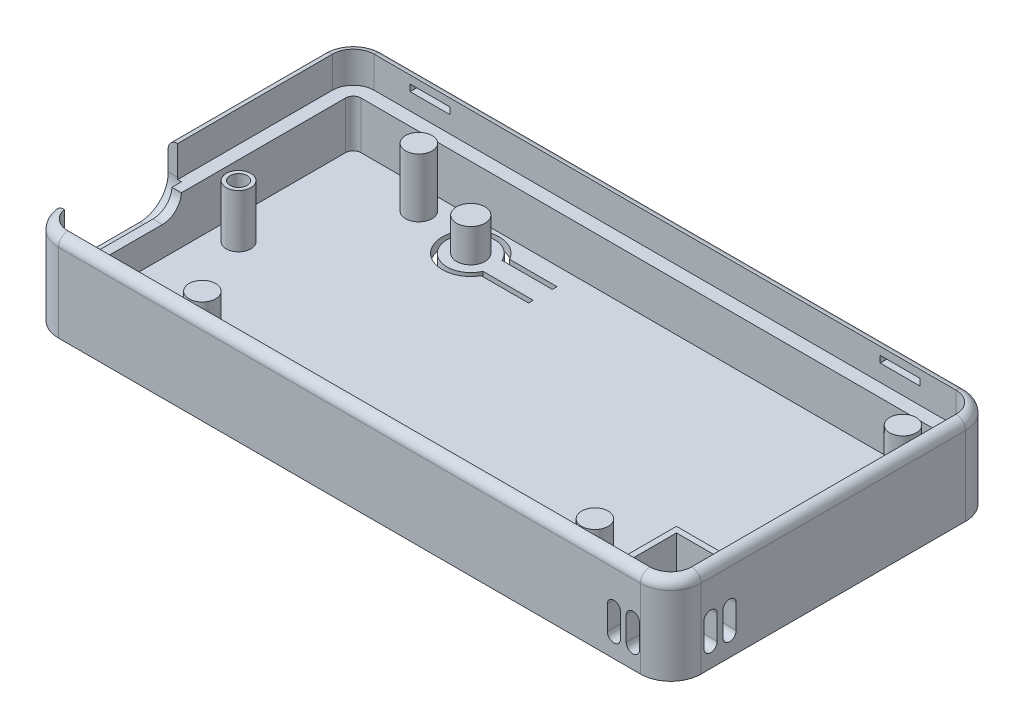
from build123d import *

# Parameters (mm, degrees)
EXTRUDE_1_DEPTH        = 9.3
CUT_EXTRUDE_1_DEPTH    = 3.3
CUT_EXTRUDE_2_DEPTH    = 5
SKETCH_5_W             = 4.2
SKETCH_5_H             = 0.7
CUT_EXTRUDE_4_DEPTH    = 0.7
FILLET_8_R             = 0.5
FILLET_8_OF_MIRROR_2_R = 0.5
FILLET_4_R             = 1
EXTRUDE_2_DEPTH        = 6.2
CUT_EXTRUDE_6_DEPTH    = 39.887305126
SKETCH_10_R            = 1.5
EXTRUDE_3_DEPTH        = 3.5
CUT_EXTRUDE_7_DEPTH    = 3
SKETCH_12_R            = 1.3
EXTRUDE_4_DEPTH        = 5.6
CUT_EXTRUDE_8_DEPTH    = 1.4
SKETCH_14_W            = 11.99666574
SKETCH_14_H            = 3.3
CUT_EXTRUDE_9_DEPTH    = 6.6
SKETCH_15_R            = 0.9
CUT_EXTRUDE_10_DEPTH   = 39.560245221
SKETCH_16_R            = 1.4
EXTRUDE_5_DEPTH        = 6.2
SKETCH_18_W            = 4.2
SKETCH_18_H            = 0.7
CUT_EXTRUDE_11_DEPTH   = 0.7
CUT_EXTRUDE_12_DEPTH   = 69.247875559
CUT_EXTRUDE_13_DEPTH   = 48.469042635
CUT_EXTRUDE_14_DEPTH   = 39.887305279


with BuildPart() as part:
    # 草图1 → 凸台-拉伸1 (new body)
    with BuildSketch(Plane(origin=(0, 0, 0), x_dir=(1, 0, 0), z_dir=(0, 1, 0))):
        with BuildLine():
            Line((-30.7, 17.15), (30.7, 17.15))
            ThreePointArc((30.7, 17.15), (32.9627417, 16.2127417), (33.9, 13.95))
            Line((33.9, 13.95), (33.9, -13.95))
            ThreePointArc((33.9, -13.95), (32.9627417, -16.2127417), (30.7, -17.15))
            Line((30.7, -17.15), (-30.7, -17.15))
            ThreePointArc((-30.7, -17.15), (-32.9627417, -16.2127417), (-33.9, -13.95))
            Line((-33.9, -13.95), (-33.9, 13.95))
            ThreePointArc((-33.9, 13.95), (-32.9627417, 16.2127417), (-30.7, 17.15))
        make_face()
    extrude(amount=EXTRUDE_1_DEPTH)

    # 草图2 → 切除-拉伸1 (cut)
    with BuildSketch(Plane(origin=(0, 9.3, 0), x_dir=(1, 0, 0), z_dir=(0, 1, 0))):
        with BuildLine():
            Line((32.9, -13.95), (32.9, 13.95))
            ThreePointArc((32.9, 13.95), (32.255634919, 15.505634919), (30.7, 16.15))
            Line((30.7, 16.15), (-30.7, 16.15))
            ThreePointArc((-30.7, 16.15), (-32.255634919, 15.505634919), (-32.9, 13.95))
            Line((-32.9, 13.95), (-32.9, -13.95))
            ThreePointArc((-32.9, -13.95), (-32.255634919, -15.505634919), (-30.7, -16.15))
            Line((-30.7, -16.15), (30.7, -16.15))
            ThreePointArc((30.7, -16.15), (32.255634919, -15.505634919), (32.9, -13.95))
        make_face()
    extrude(amount=-CUT_EXTRUDE_1_DEPTH, mode=Mode.SUBTRACT)

    # 草图3 → 切除-拉伸2 (cut)
    with BuildSketch(Plane(origin=(0, 6, 0), x_dir=(1, 0, 0), z_dir=(0, 1, 0))):
        with BuildLine():
            Line((31.5, -13.95), (31.5, 13.95))
            ThreePointArc((31.5, 13.95), (31.265685425, 14.515685425), (30.7, 14.75))
            Line((30.7, 14.75), (-30.7, 14.75))
            ThreePointArc((-30.7, 14.75), (-31.265685425, 14.515685425), (-31.5, 13.95))
            Line((-31.5, 13.95), (-31.5, -13.95))
            ThreePointArc((-31.5, -13.95), (-31.265685425, -14.515685425), (-30.7, -14.75))
            Line((-30.7, -14.75), (30.7, -14.75))
            ThreePointArc((30.7, -14.75), (31.265685425, -14.515685425), (31.5, -13.95))
        make_face()
    extrude(amount=-CUT_EXTRUDE_2_DEPTH, mode=Mode.SUBTRACT)

    # 草图5 → 切除-拉伸4 (cut)
    with BuildSketch(Plane(origin=(0, 0, 16.15), x_dir=(-1, 0, 0), z_dir=(0, 0, -1))):
        with Locations((-24.8, 8.12)):
            Rectangle(SKETCH_5_W, SKETCH_5_H)
        with Locations((24.8, 8.12)):
            Rectangle(SKETCH_5_W, SKETCH_5_H)
    cut_extrude_4 = extrude(amount=-CUT_EXTRUDE_4_DEPTH, mode=Mode.SUBTRACT)

    # 圆角8
    fillet_8_edges = [part.edges().sort_by_distance(p)[0] for p in [
        (24.8, 8.47, 16.85),
        (-24.8, 8.47, 16.85),
    ]]
    fillet(fillet_8_edges, radius=FILLET_8_R)

    # 镜向2: 切除-拉伸4 across plane
    add(cut_extrude_4.mirror(Plane.XY), mode=Mode.SUBTRACT)

    # 圆角8 of 镜向2
    fillet_8_of_mirror_2_edges = [part.edges().sort_by_distance(p)[0] for p in [
        (24.8, 8.47, -16.85),
        (-24.8, 8.47, -16.85),
    ]]
    fillet(fillet_8_of_mirror_2_edges, radius=FILLET_8_OF_MIRROR_2_R)

    # 圆角4
    fillet_4_edges = [part.edges().sort_by_distance(p)[0] for p in [
        (-32.9627417, 9.3, -16.2127417),
        (-33.9, 9.3, 0),
        (-32.9627417, 9.3, 16.2127417),
        (0, 9.3, 17.15),
        (32.9627417, 9.3, 16.2127417),
        (33.9, 9.3, 0),
        (32.9627417, 9.3, -16.2127417),
        (0, 9.3, -17.15),
    ]]
    fillet(fillet_4_edges, radius=FILLET_4_R - 0.0001)  # a hair under: the kernel refuses the full size

    # 草图8 → 凸台-拉伸2 (add)
    with BuildSketch(Plane(origin=(0, 1, 0), x_dir=(1, 0, 0), z_dir=(0, 1, 0))):
        Polygon((26.3, -14.75), (26.3, -8.95), (31.5, -8.95), (31.5, -9.55), (26.9, -9.55), (26.9, -14.75), align=None)
    extrude(amount=EXTRUDE_2_DEPTH)

    # 草图9 → 切除-拉伸6 (cut, through all)
    with BuildSketch(Plane(origin=(0, 1, 0), x_dir=(1, 0, 0), z_dir=(0, 1, 0))):
        with BuildLine():
            Line((-13.101923789, 12.85), (-8.101923789, 12.85))
            Line((-8.101923789, 12.85), (-8.101923789, 12.35))
            Line((-8.101923789, 12.35), (-13.408712153, 12.35))
            ThreePointArc((-13.408712153, 12.35), (-18.2, 11.35), (-13.408712153, 10.35))
            Line((-13.408712153, 10.35), (-8.101923789, 10.35))
            Line((-8.101923789, 10.35), (-8.101923789, 9.85))
            Line((-8.101923789, 9.85), (-13.101923789, 9.85))
            ThreePointArc((-13.101923789, 9.85), (-18.7, 11.35), (-13.101923789, 12.85))
        make_face()
    extrude(amount=-CUT_EXTRUDE_6_DEPTH, mode=Mode.SUBTRACT)

    # 草图10 → 凸台-拉伸3 (add)
    with BuildSketch(Plane(origin=(0, 1, 0), x_dir=(1, 0, 0), z_dir=(0, 1, 0))):
        with Locations(Location((-15.7, 11.35, 0), (0, 0, 90))):
            Circle(SKETCH_10_R)
    extrude(amount=EXTRUDE_3_DEPTH)

    # 草图11 → 切除-拉伸7 (cut)
    with BuildSketch(Plane(origin=(-31.5, 0, 0), x_dir=(0, 0, -1), z_dir=(1, 0, 0))):
        with BuildLine():
            Line((-11.38, 8.1), (-5.38, 8.1))
            ThreePointArc((-5.38, 8.1), (-3.38, 6.1), (-5.38, 4.1))
            Line((-5.38, 4.1), (-11.38, 4.1))
            ThreePointArc((-11.38, 4.1), (-13.38, 6.1), (-11.38, 8.1))
        make_face()
    extrude(amount=-CUT_EXTRUDE_7_DEPTH, mode=Mode.SUBTRACT)

    # 草图12 → 凸台-拉伸4 (add)
    with BuildSketch(Plane(origin=(0, 1, 0), x_dir=(1, 0, 0), z_dir=(0, 1, 0))):
        with Locations(Location((-29, 0.15, 0), (0, 0, 90))):
            Circle(SKETCH_12_R)
    extrude(amount=EXTRUDE_4_DEPTH)

    # 草图13 → 切除-拉伸8 (cut)
    with BuildSketch(Plane.ZY.offset(33.9)):
        with BuildLine():
            Line((11.38, 9.1), (5.38, 9.1))
            ThreePointArc((5.38, 9.1), (2.38, 6.1), (5.38, 3.1))
            Line((5.38, 3.1), (11.38, 3.1))
            ThreePointArc((11.38, 3.1), (14.38, 6.1), (11.38, 9.1))
        make_face()
    extrude(amount=-CUT_EXTRUDE_8_DEPTH, mode=Mode.SUBTRACT)

    # 草图14 → 切除-拉伸9 (cut)
    with BuildSketch(Plane.ZY.offset(33.9)):
        with Locations((8.38, 7.65)):
            Rectangle(SKETCH_14_W, SKETCH_14_H)
    extrude(amount=-CUT_EXTRUDE_9_DEPTH, mode=Mode.SUBTRACT)

    # 草图15 → 切除-拉伸10 (cut, through all)
    with BuildSketch(Plane(origin=(0, 6.6, 0), x_dir=(1, 0, 0), z_dir=(0, 1, 0))):
        with Locations(Location((-29, 0.15, 0), (0, 0, 270))):
            Circle(SKETCH_15_R)
    extrude(amount=-CUT_EXTRUDE_10_DEPTH, mode=Mode.SUBTRACT)

    # 草图16 → 凸台-拉伸5 (add)
    with BuildSketch(Plane(origin=(0, 1, 0), x_dir=(1, 0, 0), z_dir=(0, 1, 0))):
        with Locations(Location((29, 12.25, 0), (0, 0, 90))):
            Circle(SKETCH_16_R)
        with Locations(Location((-20.2, -12.47, 0), (0, 0, 90))):
            Circle(SKETCH_16_R)
        with Locations(Location((21.3, -12.55, 0), (0, 0, 90))):
            Circle(SKETCH_16_R)
        with Locations(Location((-22.3, 12.47, 0), (0, 0, 90))):
            Circle(SKETCH_16_R)
    extrude(amount=EXTRUDE_5_DEPTH)

    # 草图18 → 切除-拉伸11 (cut)
    with BuildSketch(Plane.ZY.offset(-32.9)):
        with Locations((0, 8.12)):
            Rectangle(SKETCH_18_W, SKETCH_18_H)
    extrude(amount=-CUT_EXTRUDE_11_DEPTH, mode=Mode.SUBTRACT)

    # 草图19 → 切除-拉伸12 (cut, through all)
    with BuildSketch(Plane.ZY.offset(-31.5)):
        with BuildLine():
            Line((11.65, 4.65), (11.65, 2.15))
            ThreePointArc((11.65, 2.15), (10.95, 1.45), (10.25, 2.15))
            Line((10.25, 2.15), (10.25, 4.65))
            ThreePointArc((10.25, 4.65), (10.95, 5.35), (11.65, 4.65))
        make_face()
        with BuildLine():
            Line((13.65, 4.65), (13.65, 2.15))
            ThreePointArc((13.65, 2.15), (12.95, 1.45), (12.25, 2.15))
            Line((12.25, 2.15), (12.25, 4.65))
            ThreePointArc((12.25, 4.65), (12.95, 5.35), (13.65, 4.65))
        make_face()
    extrude(amount=-CUT_EXTRUDE_12_DEPTH, mode=Mode.SUBTRACT)

    # 草图20 → 切除-拉伸13 (cut, through all)
    with BuildSketch(Plane(origin=(0, 0, 14.75), x_dir=(-1, 0, 0), z_dir=(0, 0, -1))):
        with BuildLine():
            Line((-27.2, 4.65), (-27.2, 2.15))
            ThreePointArc((-27.2, 2.15), (-27.9, 1.45), (-28.6, 2.15))
            Line((-28.6, 2.15), (-28.6, 4.65))
            ThreePointArc((-28.6, 4.65), (-27.9, 5.35), (-27.2, 4.65))
        make_face()
        with BuildLine():
            Line((-29.2, 4.65), (-29.2, 2.15))
            ThreePointArc((-29.2, 2.15), (-29.9, 1.45), (-30.6, 2.15))
            Line((-30.6, 2.15), (-30.6, 4.65))
            ThreePointArc((-30.6, 4.65), (-29.9, 5.35), (-29.2, 4.65))
        make_face()
    extrude(amount=-CUT_EXTRUDE_13_DEPTH, mode=Mode.SUBTRACT)

    # 草图21 → 切除-拉伸14 (cut, through all)
    with BuildSketch(Plane(origin=(0, 1, 0), x_dir=(1, 0, 0), z_dir=(0, 1, 0))):
        with BuildLine():
            Line((28.9, -11.15), (28.9, -13.15))
            ThreePointArc((28.9, -13.15), (28.2, -13.85), (27.5, -13.15))
            Line((27.5, -13.15), (27.5, -11.15))
            ThreePointArc((27.5, -11.15), (28.2, -10.45), (28.9, -11.15))
        make_face()
        with BuildLine():
            Line((30.9, -11.15), (30.9, -13.15))
            ThreePointArc((30.9, -13.15), (30.2, -13.85), (29.5, -13.15))
            Line((29.5, -13.15), (29.5, -11.15))
            ThreePointArc((29.5, -11.15), (30.2, -10.45), (30.9, -11.15))
        make_face()
    extrude(amount=-CUT_EXTRUDE_14_DEPTH, mode=Mode.SUBTRACT)


solid = part.part
